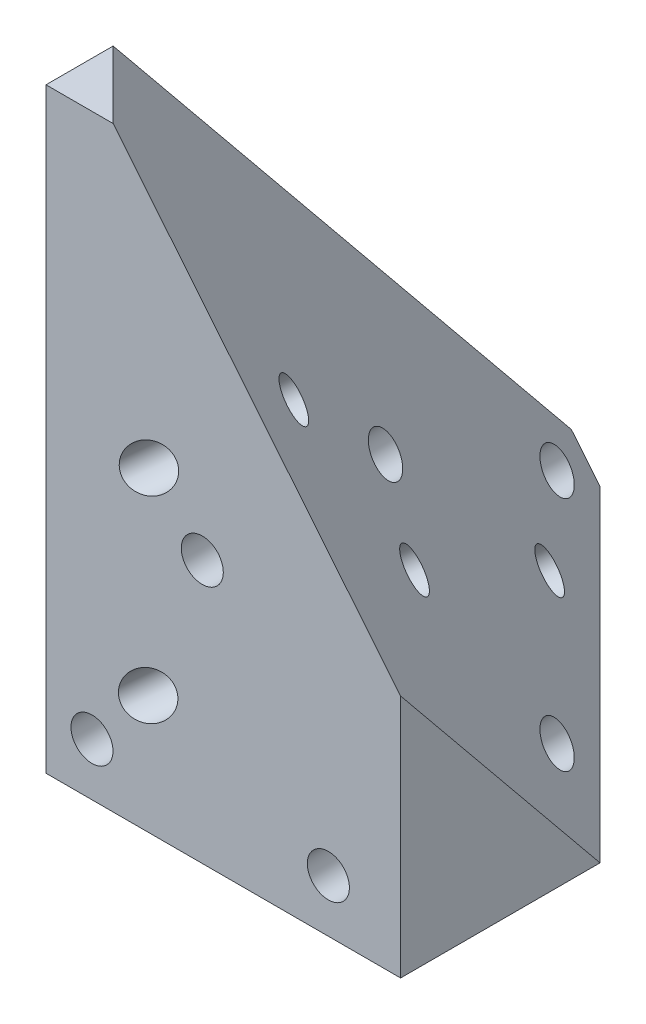
from build123d import *

# Parameters (mm, degrees)
SKETCH1_W                       = 13.5
SKETCH1_H                       = 20
BOSS_EXTRUDE1_DEPTH             = 22.7
SKETCH2_W                       = 50.012416784
SKETCH2_H                       = 57.752903126
CUT_EXTRUDE1_DEPTH              = 22.738253376
M2X0_4_TAPPED_HOLE1_D           = 1.6
M2X0_4_TAPPED_HOLE1_ON_FACE_2_D = 1.6
M2X0_4_TAPPED_HOLE1_ON_FACE_3_D = 1.6
M2X0_4_TAPPED_HOLE3_D           = 1.6


with BuildPart() as part:
    # Sketch1 → Boss-Extrude1 (new body)
    with BuildSketch(Plane(origin=(0, 0, 0), x_dir=(1, 0, 0), z_dir=(0, 1, 0))):
        with Locations((6.75, 10)):
            Rectangle(SKETCH1_W, SKETCH1_H)
    extrude(amount=BOSS_EXTRUDE1_DEPTH)

    # Sketch2 → Cut-Extrude1 (cut, through all)
    with BuildSketch(Plane(origin=(7.909175957, 6.457815127, -7.909175957), x_dir=(0.7905694150420965, -0.3872983346207431, 0.4743416490252531), z_dir=(-0.6123724356957925, -0.5000000000000046, 0.6123724356957929))):
        Rectangle(SKETCH2_W, SKETCH2_H)
    extrude(amount=-CUT_EXTRUDE1_DEPTH, mode=Mode.SUBTRACT)

    # M2x0.4 Tapped Hole1 (through all)
    with Locations(Plane(origin=(6.676828291, 14.276195347, -2.757842905), x_dir=(-0.707106781187, 0, -0.707106781187), z_dir=(0.612372435696, 0.5, -0.612372435696))):
        with Locations((0, 0)):
            Hole(M2X0_4_TAPPED_HOLE1_D / 2)

    # M2x0.4 Tapped Hole1 on face 2 (through all)
    with Locations(Plane(origin=(8.960116926, 8.647059392, -5.07072453), x_dir=(-0.707106781187, 0, -0.707106781187), z_dir=(0.612372326772, 0.500000266808, -0.612372326772))):
        with Locations((0, 0)):
            Hole(M2X0_4_TAPPED_HOLE1_ON_FACE_2_D / 2)

    # M2x0.4 Tapped Hole1 on face 3 (through all)
    with Locations(Plane(origin=(5.257385282, 2.349364905, -13.91550219), x_dir=(-0.707106781187, 0, -0.707106781187), z_dir=(0.612372326772, 0.500000266808, -0.612372326772))):
        with Locations((0, 0)):
            Hole(M2X0_4_TAPPED_HOLE1_ON_FACE_3_D / 2)

    # M2x0.4 Tapped Hole3 (through all)
    with Locations(Plane(origin=(5.95, 10, 0), x_dir=(1, 0, 0), z_dir=(0, 0, 1))):
        with Locations((0, 0), (-4.2, -8), (4.8, -8)):
            Hole(M2X0_4_TAPPED_HOLE3_D / 2)


solid = part.part
